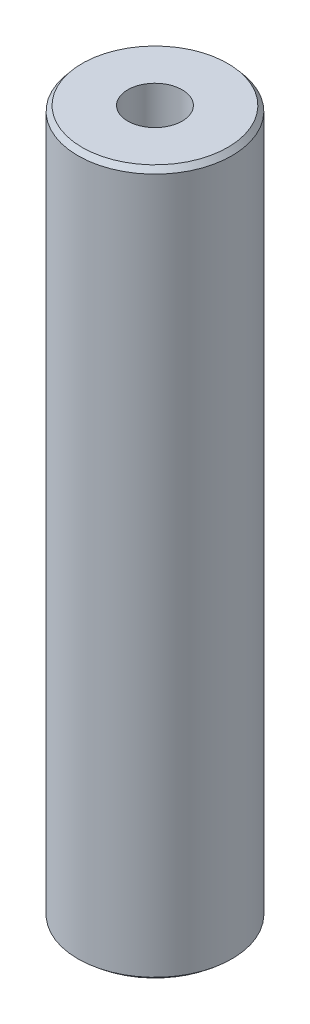
from build123d import *
from OCP.BRepFilletAPI import BRepFilletAPI_MakeChamfer

# Parameters (mm, degrees)
SKETCH1_R           = 22.5
BOSS_EXTRUDE1_DEPTH = 205.954816179
SKETCH2_R           = 7.948794354
CUT_EXTRUDE1_DEPTH  = 209.398383649
CHAMFER1_SIZE       = 1.487284648
CHAMFER1_SIZE2      = 1.23192159


with BuildPart() as part:
    # Sketch1 → Boss-Extrude1 (new body)
    with BuildSketch(Plane(origin=(0, 0, 0), x_dir=(1, 0, 0), z_dir=(0, 1, 0))):
        Circle(SKETCH1_R)
    extrude(amount=BOSS_EXTRUDE1_DEPTH)

    # Sketch2 → Cut-Extrude1 (cut, through all)
    with BuildSketch(Plane(origin=(0, 0, 0), x_dir=(1, 0, 0), z_dir=(0, 1, 0))):
        Circle(SKETCH2_R)
    extrude(amount=CUT_EXTRUDE1_DEPTH, mode=Mode.SUBTRACT)

    # Chamfer1: one chamfer whose edges measure the first distance from different faces: ONE call of the kernel's chamfer builder (chamfer() names one face for all edges)
    chamfer1_edges_1 = [part.edges().sort_by_distance(p)[0] for p in [
        (-22.5, 205.954816179, 0),
    ]]
    chamfer1_side_1 = [part.faces().sort_by_distance(p)[0] for p in [
        (-22.5, 102.97740809, 0),
    ]]
    chamfer1_edges_2 = [part.edges().sort_by_distance(p)[0] for p in [
        (-22.5, 0, 0),
    ]]
    chamfer1_side_2 = [part.faces().sort_by_distance(p)[0] for p in [
        (-21.863603897, 0, 0),
    ]]
    chamfer1 = BRepFilletAPI_MakeChamfer(part.part.solid().wrapped)
    for e in chamfer1_edges_1:
        chamfer1.Add(CHAMFER1_SIZE, CHAMFER1_SIZE2, e.wrapped, chamfer1_side_1[0].wrapped)  # the first distance lies on this face
    for e in chamfer1_edges_2:
        chamfer1.Add(CHAMFER1_SIZE, CHAMFER1_SIZE2, e.wrapped, chamfer1_side_2[0].wrapped)  # the first distance lies on this face
    add(Compound.cast(chamfer1.Shape()), mode=Mode.REPLACE)


solid = part.part
